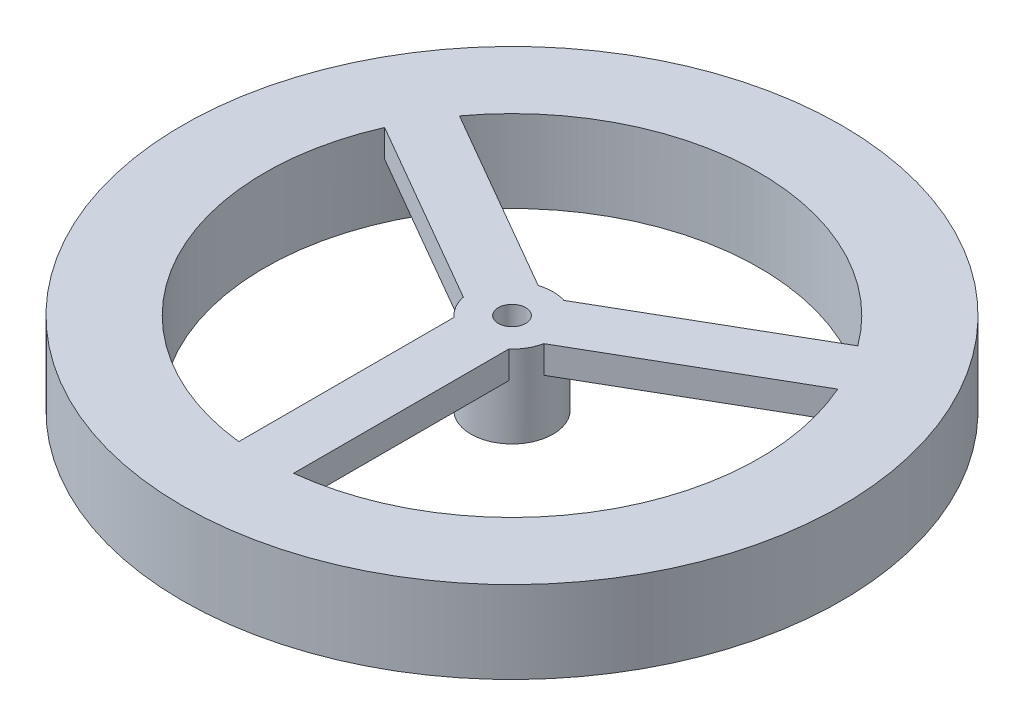
from build123d import *

# Parameters (mm, degrees)
SKETCH1_R             = 60.124
SKETCH1_R_2           = 45.124
BOSS_EXTRUDE1_DEPTH   = 15
SKETCH1_R_3           = 7.5
SKETCH1_R_4           = 2.5
BOSS_EXTRUDE1_2_DEPTH = 15
SKETCH2_W             = 10
SKETCH2_H             = 39.533830056
BOSS_EXTRUDE2_DEPTH   = 5
CIRPATTERN1_COUNT     = 3


with BuildPart() as part:
    # Sketch1 → Boss-Extrude1 (new body)
    with BuildSketch(Plane(origin=(0, 0, 0), x_dir=(1, 0, 0), z_dir=(0, 1, 0))):
        Circle(SKETCH1_R)
        Circle(SKETCH1_R_2, mode=Mode.SUBTRACT)
    extrude(amount=-BOSS_EXTRUDE1_DEPTH)



with BuildPart() as body_2:
    # Sketch1 → Boss-Extrude1 2 (new body)
    with BuildSketch(Plane(origin=(0, 0, 0), x_dir=(1, 0, 0), z_dir=(0, 1, 0))):
        Circle(SKETCH1_R_3)
        Circle(SKETCH1_R_4, mode=Mode.SUBTRACT)
    extrude(amount=-BOSS_EXTRUDE1_2_DEPTH)


with BuildPart() as part_1:
    add(part.part)

    add(body_2.part)  # Boss-Extrude2 merges body 2
    # Sketch2 → Boss-Extrude2 (add)
    with BuildSketch(Plane(origin=(0, 0, 0), x_dir=(1, 0, 0), z_dir=(0, 1, 0))):
        with Locations((0, -25.357084972)):
            Rectangle(SKETCH2_W, SKETCH2_H)
    boss_extrude2 = extrude(amount=-BOSS_EXTRUDE2_DEPTH)

    # CirPattern1: Boss-Extrude2 ×3 about axis
    cirpattern1_axis = Axis((0, -15, 0), (0, 1, 0))
    for i in range(1, CIRPATTERN1_COUNT):
        add(boss_extrude2.rotate(cirpattern1_axis, i * 360 / CIRPATTERN1_COUNT))


solid = part_1.part
